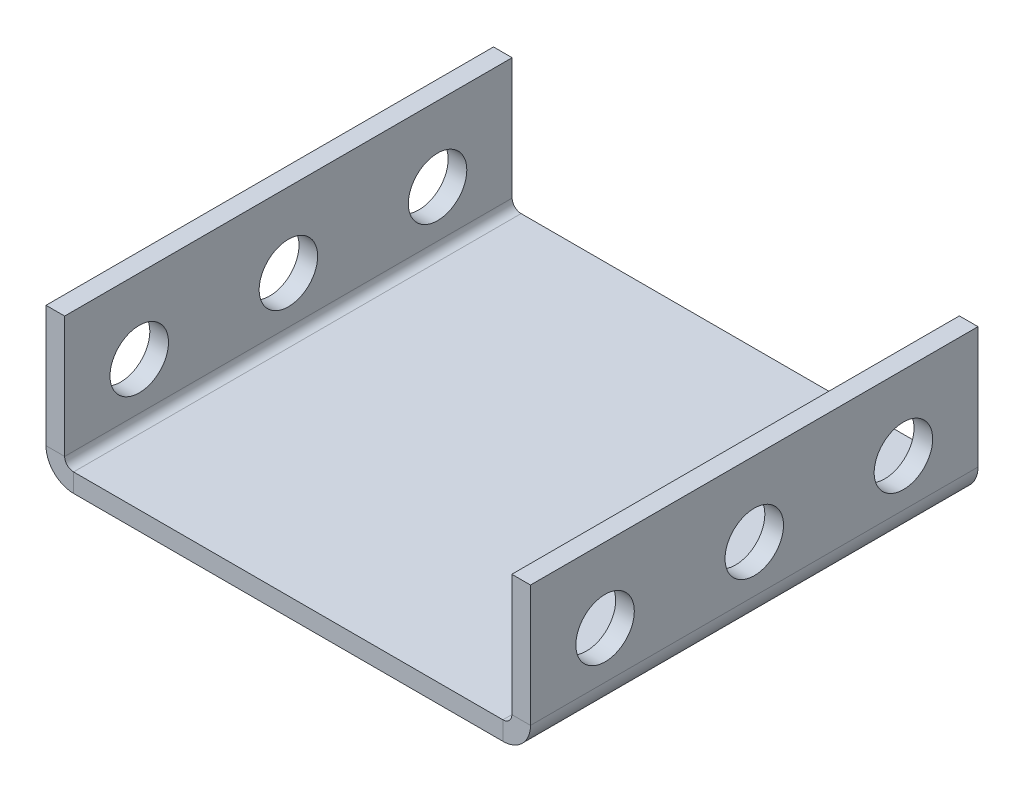
from build123d import *

# Parameters (mm, degrees)
BASE_FLANGE1_DEPTH      = 38.1
CUT_EXTRUDE1_DEPTH      = 46.147340731
CUT_EXTRUDE1_DEPTH_BACK = 46.147340731
SKETCH6_R               = 2.4892


# Sheet-metal steps are written as plain solids
with BuildPart() as part:
    # Sketch1 → Base-Flange1 (new body)
    with BuildSketch(Plane.XY):
        with BuildLine():
            Line((-20.6248, 12.7), (-20.6248, 2.3495))
            ThreePointArc((-20.6248, 2.3495), (-19.936647382, 0.688152618), (-18.2753, 0))
            Line((-18.2753, 0), (18.2753, 0))
            ThreePointArc((18.2753, 0), (19.936647382, 0.688152618), (20.6248, 2.3495))
            Line((20.6248, 2.3495), (20.6248, 12.7))
            Line((20.6248, 12.7), (19.0373, 12.7))
            Line((19.0373, 12.7), (19.0373, 2.3495))
            ThreePointArc((19.0373, 2.3495), (18.814115367, 1.810684633), (18.2753, 1.5875))
            Line((18.2753, 1.5875), (-18.2753, 1.5875))
            ThreePointArc((-18.2753, 1.5875), (-18.814115367, 1.810684633), (-19.0373, 2.3495))
            Line((-19.0373, 2.3495), (-19.0373, 12.7))
            Line((-19.0373, 12.7), (-20.6248, 12.7))
        make_face()
    extrude(amount=BASE_FLANGE1_DEPTH)

    # Sketch6 → Cut-Extrude1 (cut, two sides: drawn at the far end of the back side and taken through both)
    with BuildSketch(Plane(origin=(0, 0, 0), x_dir=(0, 0, -1), z_dir=(1, 0, 0)).offset(-CUT_EXTRUDE1_DEPTH_BACK)):
        with Locations((-31.75, 6.35)):
            Circle(SKETCH6_R)
        with Locations((-19.05, 6.35)):
            Circle(SKETCH6_R)
        with Locations((-6.35, 6.35)):
            Circle(SKETCH6_R)
        with Locations((6.35, 6.35)):
            Circle(SKETCH6_R)
        with Locations((19.05, 6.35)):
            Circle(SKETCH6_R)
    extrude(amount=CUT_EXTRUDE1_DEPTH + CUT_EXTRUDE1_DEPTH_BACK, mode=Mode.SUBTRACT)


solid = part.part
